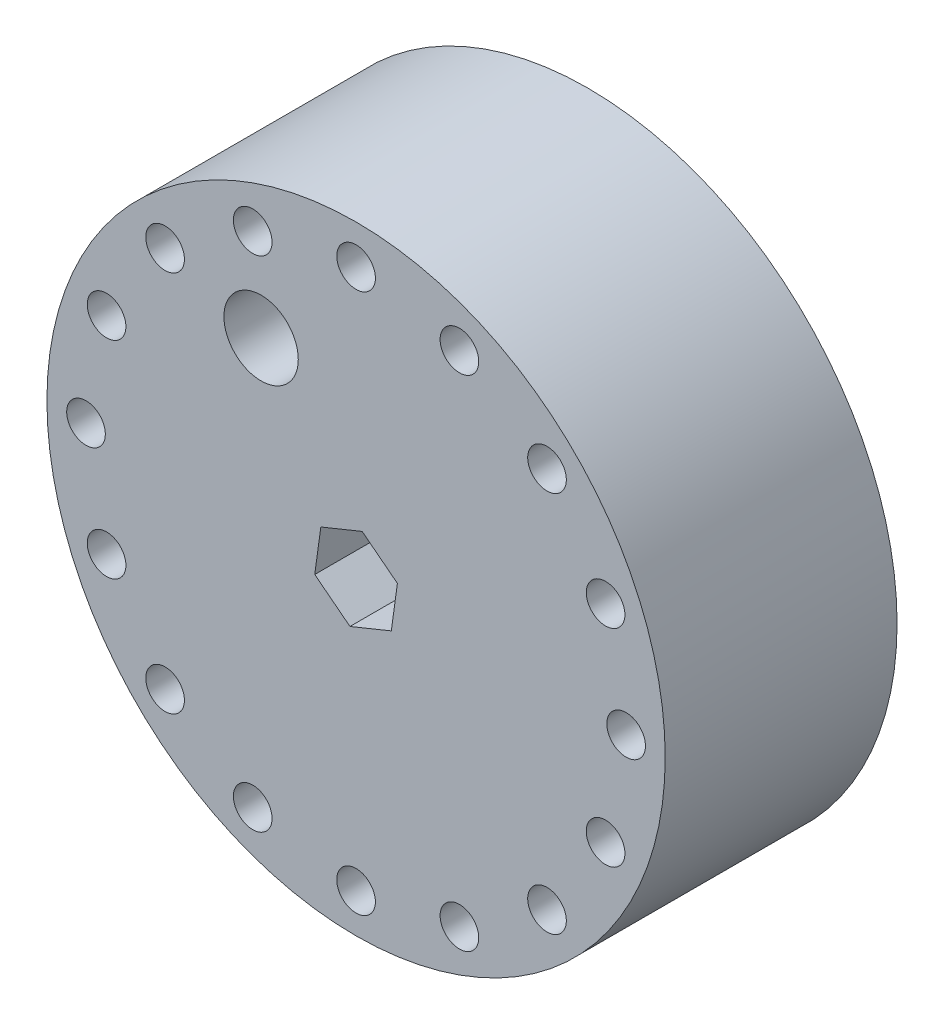
from build123d import *

# Parameters (mm, degrees)
SKETCH1_R           = 50.8
BOSS_EXTRUDE1_DEPTH = 38.1
SKETCH2_R           = 3.175
CUT_EXTRUDE1_DEPTH  = 82.319677815
SKETCH3_R           = 6.109060529
CUT_EXTRUDE2_DEPTH  = 82.319677815


with BuildPart() as part:
    # Sketch1 → Boss-Extrude1 (new body)
    with BuildSketch(Plane.XY):
        Circle(SKETCH1_R)
        Polygon((5.789348381, -4.499642059), (6.791478521, 2.76390174), (1.00213014, 7.263543799), (-5.789348381, 4.499642059), (-6.791478521, -2.76390174), (-1.00213014, -7.263543799), align=None, mode=Mode.SUBTRACT)
    extrude(amount=BOSS_EXTRUDE1_DEPTH)

    # Sketch2 → Cut-Extrude1 (cut, through all)
    with BuildSketch(Plane.XY.offset(38.1)):
        with Locations((0, 44.377138181)):
            Circle(SKETCH2_R)
        with Locations((16.982395558, 40.999129677)):
            Circle(SKETCH2_R)
        with Locations((31.379375337, 31.379375337)):
            Circle(SKETCH2_R)
        with Locations((40.999129677, 16.982395558)):
            Circle(SKETCH2_R)
        with Locations((44.377138181, 0)):
            Circle(SKETCH2_R)
        with Locations((40.999129677, -16.982395558)):
            Circle(SKETCH2_R)
        with Locations((31.379375337, -31.379375337)):
            Circle(SKETCH2_R)
        with Locations((16.982395558, -40.999129677)):
            Circle(SKETCH2_R)
        with Locations((0, -44.377138181)):
            Circle(SKETCH2_R)
        with Locations((-16.982395558, -40.999129677)):
            Circle(SKETCH2_R)
        with Locations((-31.379375337, -31.379375337)):
            Circle(SKETCH2_R)
        with Locations((-40.999129677, -16.982395558)):
            Circle(SKETCH2_R)
        with Locations((-44.377138181, 0)):
            Circle(SKETCH2_R)
        with Locations((-40.999129677, 16.982395558)):
            Circle(SKETCH2_R)
        with Locations((-31.379375337, 31.379375337)):
            Circle(SKETCH2_R)
        with Locations((-16.982395558, 40.999129677)):
            Circle(SKETCH2_R)
    extrude(amount=-CUT_EXTRUDE1_DEPTH, mode=Mode.SUBTRACT)

    # Sketch3 → Cut-Extrude2 (cut, through all)
    with BuildSketch(Plane.XY.offset(38.1)):
        with Locations((-15.606048404, 26.480475749)):
            Circle(SKETCH3_R)
    extrude(amount=-CUT_EXTRUDE2_DEPTH, mode=Mode.SUBTRACT)


solid = part.part
